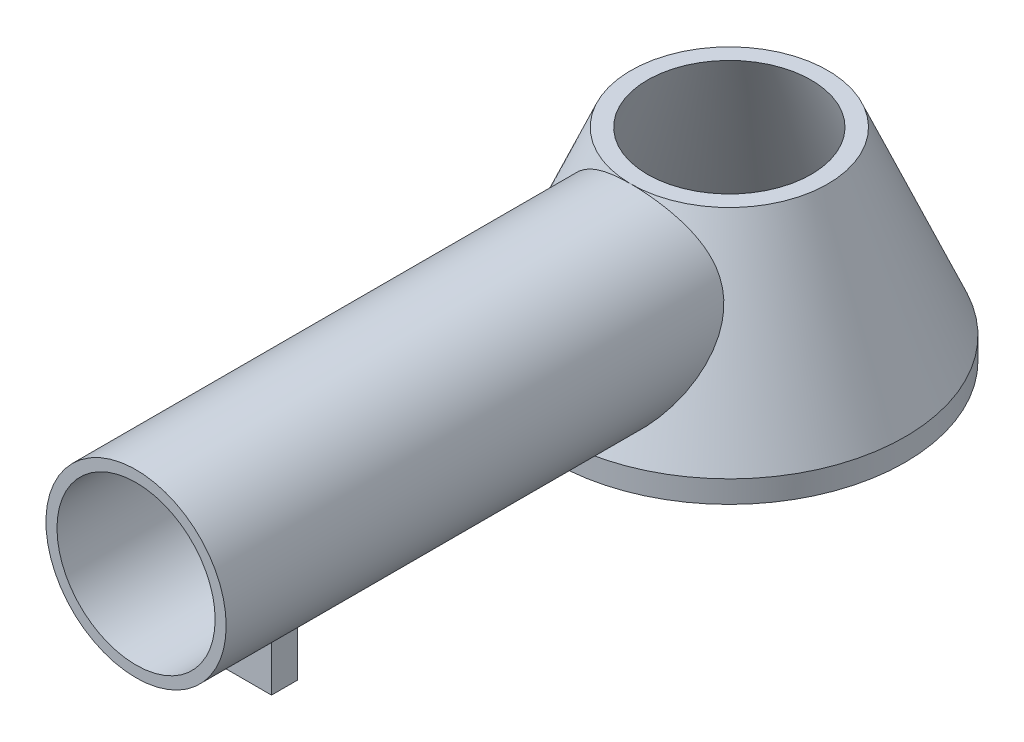
from build123d import *
from build123d.topology import SkipClean

# Parameters (mm, degrees)
SKETCH6_R                 = 8.15
SKETCH6_R_2               = 7.15
BOSS_EXTRUDE3_DEPTH       = 46.25
SKETCH12_R                = 15.9
SKETCH12_R_2              = 14.4
BOSS_EXTRUDE10_DEPTH      = 2
THREAD1_PITCH             = 0.25
CUT_EXTRUDE1_START        = -60
SKETCH15_R                = 7.15
CUT_EXTRUDE1_DEPTH        = 60
BOSS_EXTRUDE11_REACH      = 54.218
BOSS_EXTRUDE11_END_RADIUS = 8.15
SKETCH16_W                = 10.957772641
SKETCH16_H                = 2.348094137
SKETCH17_R                = 7.15
SKETCH17_R_2              = 6
BOSS_EXTRUDE12_DEPTH      = 1


with BuildPart() as part:
    # Sketch6 → Boss-Extrude3 (new body)
    with BuildSketch(Plane.XY):
        Circle(SKETCH6_R)
        Circle(SKETCH6_R_2, mode=Mode.SUBTRACT)
    extrude(amount=BOSS_EXTRUDE3_DEPTH)

    # Sketch10 → Revolve1 (revolve)
    with BuildSketch(Plane(origin=(0, 0, 0), x_dir=(0, 0, -1), z_dir=(1, 0, 0))):
        Polygon((-8.5, -8.15), (-1.5, 8.15), (0, 8.15), (-7, -8.15), align=None)
    revolve(axis=Axis((0, 14.633745637, -7.4), (0, -1, 0)))

    # Sketch12 → Boss-Extrude10 (add)
    with BuildSketch(Plane.XZ.offset(8.15)):
        with Locations(Location((0, -7.4, 0), (0, 0, 90))):
            Circle(SKETCH12_R)
        with Locations(Location((0, -7.4, 0), (0, 0, 90))):
            Circle(SKETCH12_R_2, mode=Mode.SUBTRACT)
    extrude(amount=BOSS_EXTRUDE10_DEPTH)

    # Thread1: the profile of Thread Profile1 profile screwed along a right-hand helix of 8 turns, 6 arcs to a turn; built about Z, then put on its axis
    thread1_z = Axis((0, 0, 0), (0, 0, 1))
    thread1_corners = [(14.4003, 0, -0.000173205), (14.4003, 0, 0.218923204), (14.264683531, 0, 0.140625), (14.264683531, 0, 0.078125)]
    with BuildLine(mode=Mode.PRIVATE) as thread1_profile:
        Line(thread1_corners[0], thread1_corners[1])
        Line(thread1_corners[1], thread1_corners[2])
        Line(thread1_corners[2], thread1_corners[3])
        Line(thread1_corners[3], thread1_corners[0])
    thread1_cap = Face(thread1_profile.wire())
    thread1_turn_angles = [0, 30, 60, 90, 120, 150, 180, 210, 240, 270, 300, 330, 360]
    thread1_turn_weights = [1, 0.8660254037844387, 1, 0.8660254037844387, 1, 0.8660254037844387, 1, 0.8660254037844387, 1, 0.8660254037844387, 1, 0.8660254037844387, 1]
    thread1_turn_rails = [Edge.make_bspline([Vector(p[0], p[1], 0).rotate(thread1_z, thread1_turn_angles[k]) / thread1_turn_weights[k] + Vector(0, 0, p[2] + THREAD1_PITCH * thread1_turn_angles[k] / 360) for k in range(13)], [0, 0, 0, 1, 1, 2, 2, 3, 3, 4, 4, 5, 5, 6, 6, 6], 2, thread1_turn_weights) for p in thread1_corners]
    thread1_turn_sides = [Face.make_surface_from_curves(thread1_turn_rails[p[0]], thread1_turn_rails[p[1]]) for p in [(0, 1), (1, 2), (2, 3), (3, 0)]]
    thread1 = Plane(origin=(0, -10.15, -7.4), x_dir=(1, 0, 0), z_dir=(0, 1, 0)) * Solid(Shell([*[p.moved(Location((0, 0, THREAD1_PITCH * i))) for i in range(8) for p in thread1_turn_sides], thread1_cap, thread1_cap.rotate(thread1_z, 2880).moved(Location((0, 0, THREAD1_PITCH * 2880 / 360)))]))
    add(thread1)

    # Sketch15 → Cut-Extrude1 (cut)
    with SkipClean():  # the faces are left unmerged after this step: merging them gives an invalid solid
        with BuildSketch(Plane.XY.offset(46.25).offset(CUT_EXTRUDE1_START)):
            with Locations(Location((0, 0, 0), (0, 0, 165.558893472))):
                Circle(SKETCH15_R)
        extrude(amount=CUT_EXTRUDE1_DEPTH, mode=Mode.SUBTRACT)

    # Boss-Extrude11: up to this cylinder (the profile starts outside it)
    with SkipClean():  # the faces are left unmerged after this step: merging them gives an invalid solid
        boss_extrude11_end = Plane(origin=(0, 0, 38.304561), z_dir=(0, 0, -1)) * Cylinder(BOSS_EXTRUDE11_END_RADIUS, 125.736, mode=Mode.PRIVATE)
        # Sketch16 → Boss-Extrude11 (add, up to the surface)
        with BuildSketch(Plane.XZ.offset(10.15), mode=Mode.PRIVATE) as boss_extrude11_sk1:
            with Locations((-0.001398973, 38.304560998)):
                Rectangle(SKETCH16_W, SKETCH16_H)
        boss_extrude11_tool1 = extrude(boss_extrude11_sk1.sketch, amount=-BOSS_EXTRUDE11_REACH, mode=Mode.PRIVATE) - boss_extrude11_end
        add(boss_extrude11_tool1.solids().sort_by_distance((-0.001399, -10.15, 38.304561))[0])

    # Sketch17 → Boss-Extrude12 (add)
    with BuildSketch(Plane(origin=(0, 0, 0), x_dir=(-1, 0, 0), z_dir=(0, 0, -1))):
        Circle(SKETCH17_R)
        Circle(SKETCH17_R_2, mode=Mode.SUBTRACT)
    extrude(amount=-BOSS_EXTRUDE12_DEPTH)


solid = part.part
